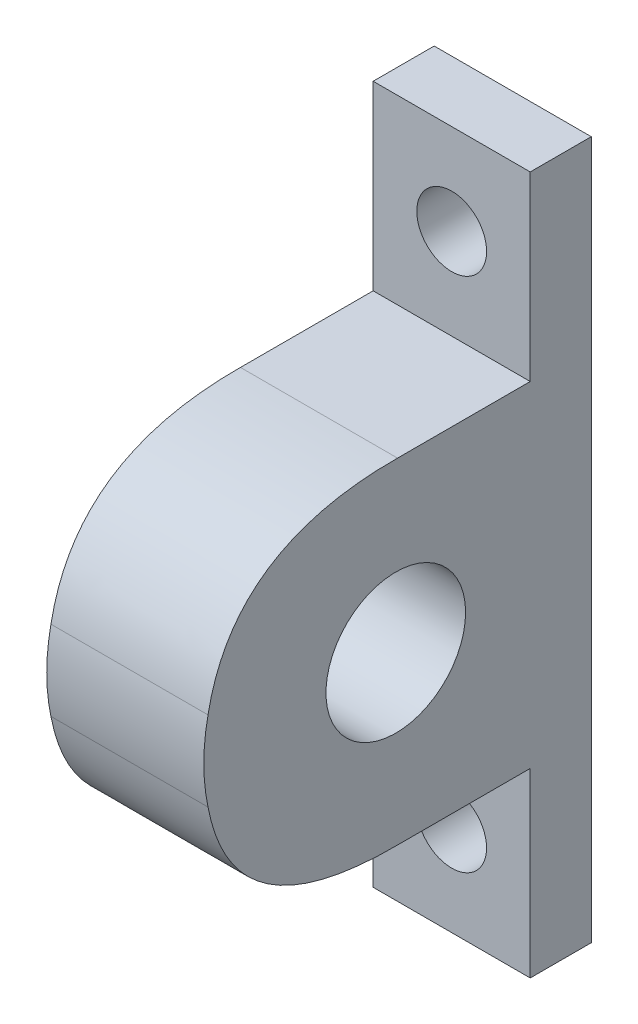
from build123d import *
from build123d.topology import SkipClean

# Parameters (mm, degrees)
SKETCH1_W           = 100
SKETCH1_H           = 22.5
BOSS_EXTRUDE1_DEPTH = 55.5
CUT_EXTRUDE1_DEPTH  = 79.016023995
SKETCH3_R           = 5
CUT_EXTRUDE2_DEPTH  = 73.059409747
SKETCH5_R           = 4.998437988
CUT_EXTRUDE3_DEPTH  = 73.059409747
SKETCH6_R           = 12
SKETCH6_R_2         = 10
BOSS_EXTRUDE2_DEPTH = 5


with BuildPart() as part:
    # Sketch1 → Boss-Extrude1 (new body)
    with BuildSketch(Plane(origin=(0, 0, 0), x_dir=(0, 1, 0), z_dir=(0, 0, 1))):
        with Locations((0, -11.25)):
            Rectangle(SKETCH1_W, SKETCH1_H)
    extrude(amount=BOSS_EXTRUDE1_DEPTH)

    # Sketch2 → Cut-Extrude1 (cut, through all)
    with BuildSketch(Plane.YZ.offset(22.5)):
        with BuildLine():
            Line((-50, 8.742021972), (-24, 8.742021972))
            Line((-24, 8.742021972), (-24, 14.574278418))
            ThreePointArc((-24, 14.574278418), (-27.5, 28), (-24, 41.425721582))
            Line((-24, 41.425721582), (-24, 55.5))
            Line((-24, 55.5), (-50, 55.5))
            Line((-50, 55.5), (-50, 8.742021972))
        make_face()
        with BuildLine():
            ThreePointArc((-24, 41.425721582), (-27.5, 28), (-24, 14.574278418))
            Line((-24, 14.574278418), (-24, 27.75))
            add(Edge.make_bspline(
                [(-24, 28.630883492), (-24.003292455, 28.193991063), (-24, 27.75)],
                knots=[0.983572463, 0.983572463, 0.983572463, 1, 1, 1], degree=2))
            Line((-24, 28.630883492), (-24, 41.425721582))
        make_face()
        with BuildLine():
            ThreePointArc((-15.102725788, 50.981681265), (-20.126720607, 46.73940014), (-24, 41.425721582))
            Line((-24, 41.425721582), (-24, 28.630883492))
            add(Edge.make_bspline(
                [(-15.102725788, 50.981681265), (-23.880610505, 44.473278164), (-24, 28.630883492)],
                knots=[0.387884574, 0.387884574, 0.387884574, 0.983572463, 0.983572463, 0.983572463], degree=2))
        make_face()
        with BuildLine():
            ThreePointArc((-24, 41.425721582), (-27.5, 28), (-24, 14.574278418))
            Line((-24, 14.574278418), (-24, 27.75))
            add(Edge.make_bspline(
                [(-24, 28.630883492), (-24.003292455, 28.193991063), (-24, 27.75)],
                knots=[0.983572463, 0.983572463, 0.983572463, 1, 1, 1], degree=2))
            Line((-24, 28.630883492), (-24, 41.425721582))
        make_face()
        with BuildLine():
            ThreePointArc((-15.102725788, 50.981681265), (-20.126720607, 46.73940014), (-24, 41.425721582))
            Line((-24, 41.425721582), (-24, 28.630883492))
            add(Edge.make_bspline(
                [(-15.102725788, 50.981681265), (-23.880610505, 44.473278164), (-24, 28.630883492)],
                knots=[0.387884574, 0.387884574, 0.387884574, 0.983572463, 0.983572463, 0.983572463], degree=2))
        make_face()
        with BuildLine():
            Line((-24, 55.5), (-24, 41.425721582))
            ThreePointArc((-24, 41.425721582), (-20.126720607, 46.73940014), (-15.102725788, 50.981681265))
            add(Edge.make_bspline(
                [(-5.719329936, 54.898685192), (-11.246534385, 53.840872164), (-15.102725788, 50.981681265)],
                knots=[0.126194361, 0.126194361, 0.126194361, 0.387884574, 0.387884574, 0.387884574], degree=2))
            ThreePointArc((-5.719329936, 54.898685192), (-2.875426682, 55.349258151), (0, 55.5))
            Line((0, 55.5), (-24, 55.5))
        make_face()
        with BuildLine():
            ThreePointArc((0, 38), (-10, 28), (0, 18))
            Line((0, 18), (0, 38))
        make_face()
        with BuildLine():
            Line((0, 38), (0, 18))
            ThreePointArc((0, 18), (7.071067812, 20.928932188), (10, 28))
            ThreePointArc((10, 28), (7.071067812, 35.071067812), (0, 38))
        make_face()
        with BuildLine():
            ThreePointArc((0, 38), (-10, 28), (0, 18))
            Line((0, 18), (0, 38))
        make_face()
        with BuildLine():
            Line((0, 38), (0, 18))
            ThreePointArc((0, 18), (7.071067812, 20.928932188), (10, 28))
            ThreePointArc((10, 28), (7.071067812, 35.071067812), (0, 38))
        make_face()
        with BuildLine():
            Line((24, 55.5), (0, 55.5))
            ThreePointArc((0, 55.5), (2.875426682, 55.349258151), (5.719329936, 54.898685192))
            add(Edge.make_bspline(
                [(5.719329936, 54.898685192), (11.246534385, 53.840872164), (15.102725788, 50.981681265)],
                knots=[0.126194361, 0.126194361, 0.126194361, 0.387884574, 0.387884574, 0.387884574], degree=2))
            ThreePointArc((15.102725788, 50.981681265), (20.126720607, 46.73940014), (24, 41.425721582))
            Line((24, 41.425721582), (24, 55.5))
        make_face()
        with BuildLine():
            Line((24, 14.574278418), (24, 8.742021972))
            Line((24, 8.742021972), (50, 8.742021972))
            Line((50, 8.742021972), (50, 14.574278418))
            Line((50, 14.574278418), (50, 55.5))
            Line((50, 55.5), (24, 55.5))
            Line((24, 55.5), (24, 41.425721582))
            ThreePointArc((24, 41.425721582), (26.610618181, 34.937218463), (27.5, 28))
            ThreePointArc((27.5, 28), (26.610618181, 21.062781537), (24, 14.574278418))
        make_face()
        with BuildLine():
            Line((24, 27.75), (24, 14.574278418))
            ThreePointArc((24, 14.574278418), (26.610618181, 21.062781537), (27.5, 28))
            ThreePointArc((27.5, 28), (26.610618181, 34.937218463), (24, 41.425721582))
            Line((24, 41.425721582), (24, 28.630883492))
            add(Edge.make_bspline(
                [(24, 28.630883492), (24.003292455, 28.193991063), (24, 27.75)],
                knots=[0.983572463, 0.983572463, 0.983572463, 1, 1, 1], degree=2))
        make_face()
        with BuildLine():
            ThreePointArc((24, 41.425721582), (20.126720607, 46.73940014), (15.102725788, 50.981681265))
            add(Edge.make_bspline(
                [(15.102725788, 50.981681265), (23.880610505, 44.473278164), (24, 28.630883492)],
                knots=[0.387884574, 0.387884574, 0.387884574, 0.983572463, 0.983572463, 0.983572463], degree=2))
            Line((24, 28.630883492), (24, 41.425721582))
        make_face()
        with BuildLine():
            Line((24, 27.75), (24, 14.574278418))
            ThreePointArc((24, 14.574278418), (26.610618181, 21.062781537), (27.5, 28))
            ThreePointArc((27.5, 28), (26.610618181, 34.937218463), (24, 41.425721582))
            Line((24, 41.425721582), (24, 28.630883492))
            add(Edge.make_bspline(
                [(24, 28.630883492), (24.003292455, 28.193991063), (24, 27.75)],
                knots=[0.983572463, 0.983572463, 0.983572463, 1, 1, 1], degree=2))
        make_face()
        with BuildLine():
            ThreePointArc((24, 41.425721582), (20.126720607, 46.73940014), (15.102725788, 50.981681265))
            add(Edge.make_bspline(
                [(15.102725788, 50.981681265), (23.880610505, 44.473278164), (24, 28.630883492)],
                knots=[0.387884574, 0.387884574, 0.387884574, 0.983572463, 0.983572463, 0.983572463], degree=2))
            Line((24, 28.630883492), (24, 41.425721582))
        make_face()
    extrude(amount=-CUT_EXTRUDE1_DEPTH, mode=Mode.SUBTRACT)

    # Sketch3 → Cut-Extrude2 (cut, through all)
    with BuildSketch(Plane.XY.offset(8.742021972)):
        with Locations((11.25, 37)):
            Circle(SKETCH3_R)
    extrude(amount=-CUT_EXTRUDE2_DEPTH, mode=Mode.SUBTRACT)

    # Sketch5 → Cut-Extrude3 (cut, through all)
    with BuildSketch(Plane.XY.offset(8.742021972)):
        with Locations((11.25, -37)):
            Circle(SKETCH5_R)
    extrude(amount=-CUT_EXTRUDE3_DEPTH, mode=Mode.SUBTRACT)

    # Sketch6 → Boss-Extrude2 (add)
    with SkipClean():  # the faces are left unmerged after this step: merging them gives an invalid solid
        with BuildSketch(Plane(origin=(0, 0, 0), x_dir=(0, -1, 0), z_dir=(-1, 0, 0))):
            with Locations((0, 28)):
                Circle(SKETCH6_R)
            with Locations((0, 28)):
                Circle(SKETCH6_R_2, mode=Mode.SUBTRACT)
        extrude(amount=BOSS_EXTRUDE2_DEPTH)


solid = part.part
